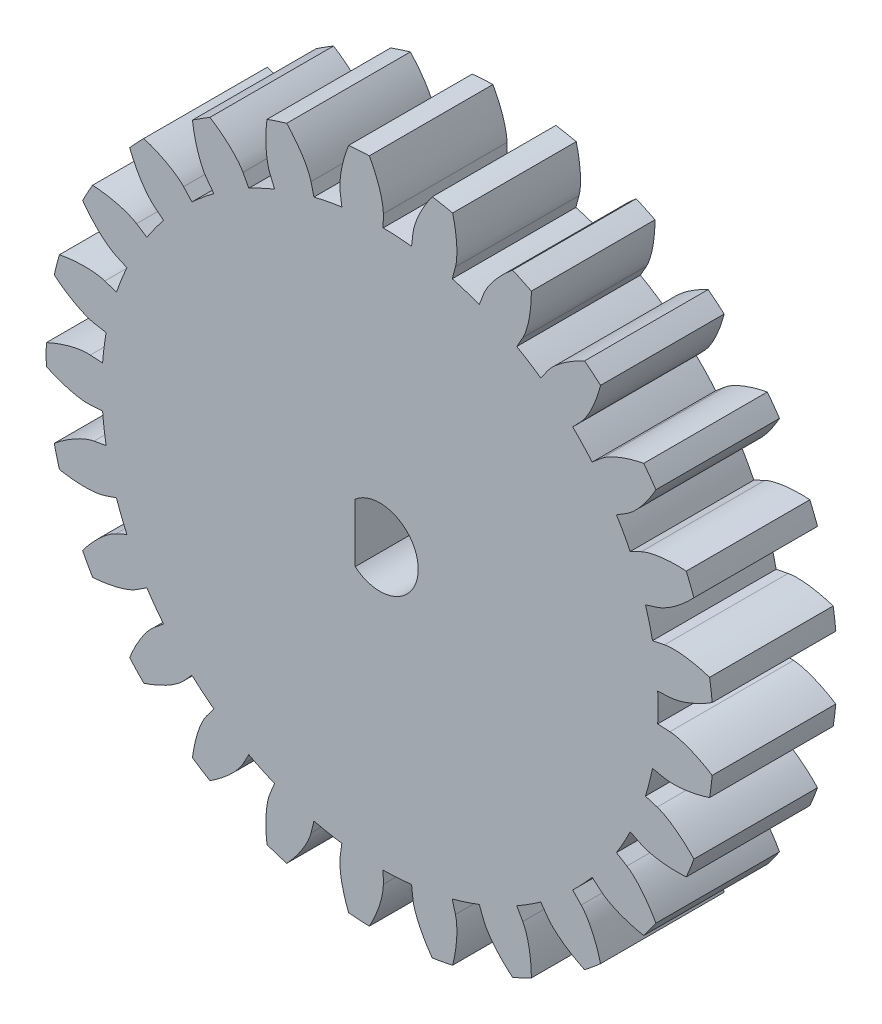
from build123d import *

# Parameters (mm, degrees)
SKETCH_1_R               = 13.5
SKETCH_1_R_2             = 1.5
EXTRUDE_1_DEPTH          = 5
CUT_EXTRUDE_1_DEPTH      = 20.735754356
PATTERN_CIRCULAR_1_DEPTH = 5
SKETCH_2_R               = 1.55
EXTRUDE_2_DEPTH          = 5
CUT_EXTRUDE_2_DEPTH      = 20.731096475


with BuildPart() as part:
    # 草图1 → 凸台-拉伸1 (new body)
    with BuildSketch(Plane.XY):
        Circle(SKETCH_1_R)
        Circle(SKETCH_1_R_2, mode=Mode.SUBTRACT)
    extrude(amount=EXTRUDE_1_DEPTH)

    # 草图1<3> → 切除-拉伸1 (cut, through all)
    with BuildSketch(Plane.XY):
        with BuildLine():
            Line((11.730793662, 0.600584865), (11.235284882, 0.575216158))
            ThreePointArc((11.235284882, 0.575216158), (11.246320619, 0.287702174), (11.25, 0))
            ThreePointArc((11.25, 0), (11.246320619, -0.287702174), (11.235284882, -0.575216158))
            Line((11.235284882, -0.575216158), (11.730793662, -0.600584865))
            add(Edge.make_bspline(
                [(11.730793662, -0.600584865), (11.775456213, -0.602871467), (11.864323988, -0.61161083), (12.031646502, -0.643255468), (12.273517711, -0.709278533), (12.66800179, -0.851104438), (13.004851693, -1.015658352), (13.259698023, -1.161601678), (13.439641435, -1.275161985)],
                knots=[0, 0, 0, 0, 0, 0.002802034, 0.005604068, 0.010661158, 0.015718248, 0.029067116, 0.029067116, 0.029067116, 0.029067116, 0.029067116], degree=4))
            ThreePointArc((13.439641435, -1.275161985), (13.484901916, -0.638294847), (13.5, 0))
            ThreePointArc((13.5, 0), (13.484901916, 0.638294847), (13.439641435, 1.275161985))
            add(Edge.make_bspline(
                [(11.730793662, 0.600584865), (11.775456213, 0.602871467), (11.864323988, 0.61161083), (12.031646502, 0.643255468), (12.273517711, 0.709278533), (12.66800179, 0.851104438), (13.004851693, 1.015658352), (13.259698023, 1.161601678), (13.439641435, 1.275161985)],
                knots=[0, 0, 0, 0, 0, 0.002802034, 0.005604068, 0.010661158, 0.015718248, 0.029067116, 0.029067116, 0.029067116, 0.029067116, 0.029067116], degree=4))
        make_face()
    extrude(amount=CUT_EXTRUDE_1_DEPTH, mode=Mode.SUBTRACT)

    # 阵列(圆周)1: read off the stored shape, not the designer's step
    # 阵列(圆周)1 outline → 阵列(圆周)1 (cut)
    with BuildSketch(Plane.XY):
        with BuildLine():
            Line((11.025358188, 2.236957045), (11.51160859, 2.335613365))
            add(Edge.make_bspline(
                [(11.51160859, 2.335613365), (11.55543664, 2.344505726), (11.643685862, 2.358141443), (11.813621332, 2.369102397), (12.064312981, 2.36530449), (12.481674285, 2.326038509), (12.848864324, 2.250425523), (13.131998817, 2.172444981), (13.334530276, 2.107202485)],
                knots=[0, 0, 0, 0, 0, 0.002802034, 0.005604068, 0.010661158, 0.015718248, 0.029067116, 0.029067116, 0.029067116, 0.029067116, 0.029067116], degree=4))
            ThreePointArc((13.334530276, 2.107202485), (13.075872675, 3.357313477), (12.700290495, 4.577403339))
            add(Edge.make_bspline(
                [(11.212889825, 3.499046139), (11.255580566, 3.512368028), (11.339483005, 3.542933345), (11.493679073, 3.615195225), (11.711532184, 3.739294979), (12.058352152, 3.974769363), (12.343696402, 4.217924677), (12.554241637, 4.42266063), (12.700290495, 4.577403339)],
                knots=[0, 0, 0, 0, 0, 0.002802034, 0.005604068, 0.010661158, 0.015718248, 0.029067116, 0.029067116, 0.029067116, 0.029067116, 0.029067116], degree=4))
            Line((11.212889825, 3.499046139), (10.739257306, 3.351246414))
            ThreePointArc((10.739257306, 3.351246414), (10.896560563, 2.797761231), (11.025358188, 2.236957045))
        make_face()
        with BuildLine():
            add(Edge.make_bspline(
                [(11.212889825, -3.499046139), (11.255580566, -3.512368028), (11.339483005, -3.542933345), (11.493679073, -3.615195225), (11.711532184, -3.739294979), (12.058352152, -3.974769363), (12.343696402, -4.217924677), (12.554241637, -4.42266063), (12.700290496, -4.577403339)],
                knots=[0, 0, 0, 0, 0, 0.002802034, 0.005604068, 0.010661158, 0.015718248, 0.029067116, 0.029067116, 0.029067116, 0.029067116, 0.029067116], degree=4))
            ThreePointArc((12.700290496, -4.577403339), (13.075872675, -3.357313477), (13.334530276, -2.107202485))
            add(Edge.make_bspline(
                [(11.51160859, -2.335613365), (11.55543664, -2.344505726), (11.643685862, -2.358141443), (11.813621332, -2.369102397), (12.064312981, -2.36530449), (12.481674285, -2.326038509), (12.848864324, -2.250425523), (13.131998817, -2.172444981), (13.334530276, -2.107202485)],
                knots=[0, 0, 0, 0, 0, 0.002802034, 0.005604068, 0.010661158, 0.015718248, 0.029067116, 0.029067116, 0.029067116, 0.029067116, 0.029067116], degree=4))
            Line((11.51160859, -2.335613365), (11.025358188, -2.236957045))
            ThreePointArc((11.025358188, -2.236957045), (10.896560563, -2.797761231), (10.739257306, -3.351246414))
            Line((10.739257306, -3.351246414), (11.212889825, -3.499046139))
        make_face()
        with BuildLine():
            add(Edge.make_bspline(
                [(9.990438883, -6.177649476), (10.028475396, -6.201169588), (10.102140601, -6.251640328), (10.233521517, -6.359978971), (10.413668018, -6.534357768), (10.691031901, -6.84868491), (10.906941268, -7.155163283), (11.059956077, -7.40582755), (11.162933596, -7.592029606)],
                knots=[0, 0, 0, 0, 0, 0.002802034, 0.005604068, 0.010661158, 0.015718248, 0.029067116, 0.029067116, 0.029067116, 0.029067116, 0.029067116], degree=4))
            ThreePointArc((11.162933596, -7.592029606), (11.83014018, -6.5036746), (12.391561538, -5.357163674))
            add(Edge.make_bspline(
                [(10.569106814, -5.125056417), (10.609346484, -5.144569001), (10.69143213, -5.179723017), (10.853302886, -5.232600844), (11.097063097, -5.291266734), (11.511077281, -5.357027901), (11.885535554, -5.375106885), (12.179167829, -5.369988931), (12.391561538, -5.357163674)],
                knots=[0, 0, 0, 0, 0, 0.002802034, 0.005604068, 0.010661158, 0.015718248, 0.029067116, 0.029067116, 0.029067116, 0.029067116, 0.029067116], degree=4))
            Line((10.569106814, -5.125056417), (10.122667691, -4.90857401))
            ThreePointArc((10.122667691, -4.90857401), (9.85845015, -5.419728834), (9.568442697, -5.916705533))
            Line((9.568442697, -5.916705533), (9.990438883, -6.177649476))
        make_face()
        with BuildLine():
            add(Edge.make_bspline(
                [(8.140251923, -8.468088376), (8.171244235, -8.500328857), (8.23004355, -8.567533757), (8.330354167, -8.705141848), (8.461474792, -8.918842827), (8.651954797, -9.292272397), (8.784862903, -9.642816664), (8.870732802, -9.923659088), (8.924168523, -10.129620732)],
                knots=[0, 0, 0, 0, 0, 0.002802034, 0.005604068, 0.010661158, 0.015718248, 0.029067116, 0.029067116, 0.029067116, 0.029067116, 0.029067116], degree=4))
            ThreePointArc((8.924168523, -10.129620732), (9.84107647, -9.24138593), (10.669985417, -8.270514567))
            add(Edge.make_bspline(
                [(8.962509186, -7.592473327), (8.996632071, -7.621380086), (9.067396396, -7.675843543), (9.211031505, -7.767315737), (9.432543926, -7.884759229), (9.817196957, -8.051415529), (10.175394874, -8.162050514), (10.461074935, -8.230116727), (10.669985417, -8.270514567)],
                knots=[0, 0, 0, 0, 0, 0.002802034, 0.005604068, 0.010661158, 0.015718248, 0.029067116, 0.029067116, 0.029067116, 0.029067116, 0.029067116], degree=4))
            Line((8.962509186, -7.592473327), (8.583932755, -7.271767217))
            ThreePointArc((8.583932755, -7.271767217), (8.200897058, -7.701154942), (7.796407643, -8.110396283))
            Line((7.796407643, -8.110396283), (8.140251923, -8.468088376))
        make_face()
        with BuildLine():
            add(Edge.make_bspline(
                [(5.778582997, -10.22644614), (5.800583747, -10.265381202), (5.840822594, -10.345097531), (5.903760029, -10.503328647), (5.977615985, -10.74292419), (6.069243553, -11.151992235), (6.110799292, -11.524576411), (6.12412876, -11.817950629), (6.124665122, -12.030730532)],
                knots=[0, 0, 0, 0, 0, 0.002802034, 0.005604068, 0.010661158, 0.015718248, 0.029067116, 0.029067116, 0.029067116, 0.029067116, 0.029067116], degree=4))
            ThreePointArc((6.124665122, -12.030730532), (7.233661732, -11.398426994), (8.27797487, -10.664198613))
            add(Edge.make_bspline(
                [(6.792764144, -9.582827214), (6.818626177, -9.61931183), (6.8736228, -9.68966259), (6.989997138, -9.813981616), (7.175343331, -9.982823304), (7.506466042, -10.239903108), (7.825896711, -10.436142491), (8.085674229, -10.573116021), (8.27797487, -10.664198613)],
                knots=[0, 0, 0, 0, 0, 0.002802034, 0.005604068, 0.010661158, 0.015718248, 0.029067116, 0.029067116, 0.029067116, 0.029067116, 0.029067116], degree=4))
            Line((6.792764144, -9.582827214), (6.505837754, -9.178048546))
            ThreePointArc((6.505837754, -9.178048546), (6.028051444, -9.498689162), (5.534495624, -9.794481007))
            Line((5.534495624, -9.794481007), (5.778582997, -10.22644614))
        make_face()
        with BuildLine():
            add(Edge.make_bspline(
                [(3.053824449, -11.342238683), (3.065451249, -11.385421892), (3.084601274, -11.472640781), (3.106210935, -11.641552679), (3.118161582, -11.891988117), (3.105179416, -12.310991386), (3.052771688, -12.682204637), (2.992723185, -12.969676868), (2.940326486, -13.175905288)],
                knots=[0, 0, 0, 0, 0, 0.002802034, 0.005604068, 0.010661158, 0.015718248, 0.029067116, 0.029067116, 0.029067116, 0.029067116, 0.029067116], degree=4))
            ThreePointArc((2.940326486, -13.175905288), (4.171729424, -12.83926297), (5.365828717, -12.387811839))
            add(Edge.make_bspline(
                [(4.196204749, -10.971056824), (4.212180923, -11.012826835), (4.247954204, -11.0946445), (4.329755544, -11.243998936), (4.467289524, -11.453629876), (4.72407626, -11.784979915), (4.984668677, -12.054493254), (5.202220874, -12.25176755), (5.365828717, -12.387811839)],
                knots=[0, 0, 0, 0, 0, 0.002802034, 0.005604068, 0.010661158, 0.015718248, 0.029067116, 0.029067116, 0.029067116, 0.029067116, 0.029067116], degree=4))
            Line((4.196204749, -10.971056824), (4.01895704, -10.507639331))
            ThreePointArc((4.01895704, -10.507639331), (3.476441187, -10.699385808), (2.92483089, -10.863142467))
            Line((2.92483089, -10.863142467), (3.053824449, -11.342238683))
        make_face()
        with BuildLine():
            add(Edge.make_bspline(
                [(0.13718288, -11.745356656), (0.137705176, -11.790074653), (0.134563112, -11.879315817), (0.113487185, -12.048295141), (0.062781619, -12.293834695), (-0.053994564, -12.696445672), (-0.197072788, -13.042963304), (-0.326726194, -13.306470611), (-0.428763677, -13.493189457)],
                knots=[0, 0, 0, 0, 0, 0.002802034, 0.005604068, 0.010661158, 0.015718248, 0.029067116, 0.029067116, 0.029067116, 0.029067116, 0.029067116], degree=4))
            ThreePointArc((-0.428763677, -13.493189457), (0.847672014, -13.473360834), (2.116527813, -13.333053289))
            add(Edge.make_bspline(
                [(1.335982377, -11.669934585), (1.341068851, -11.714365427), (1.355371022, -11.802509093), (1.397459485, -11.967514451), (1.478539488, -12.204762759), (1.644855392, -12.589563092), (1.830235577, -12.915415873), (1.99189285, -13.160595466), (2.116527813, -13.333053289)],
                knots=[0, 0, 0, 0, 0, 0.002802034, 0.005604068, 0.010661158, 0.015718248, 0.029067116, 0.029067116, 0.029067116, 0.029067116, 0.029067116], degree=4))
            Line((1.335982377, -11.669934585), (1.279550475, -11.176996492))
            ThreePointArc((1.279550475, -11.176996492), (0.706393345, -11.227800695), (0.131388275, -11.249232735))
            Line((0.131388275, -11.249232735), (0.13718288, -11.745356656))
        make_face()
        with BuildLine():
            add(Edge.make_bspline(
                [(-2.788078394, -11.410470673), (-2.798693421, -11.453913662), (-2.823930146, -11.539569751), (-2.886367383, -11.697998909), (-2.996543144, -11.923214425), (-3.209775867, -12.284135582), (-3.434534457, -12.584184618), (-3.625646165, -12.807169868), (-3.770913041, -12.962646907)],
                knots=[0, 0, 0, 0, 0, 0.002802034, 0.005604068, 0.010661158, 0.015718248, 0.029067116, 0.029067116, 0.029067116, 0.029067116, 0.029067116], degree=4))
            ThreePointArc((-3.770913041, -12.962646907), (-2.529647747, -13.260877885), (-1.265762319, -13.440529965))
            add(Edge.make_bspline(
                [(-1.608184681, -11.635547437), (-1.614307509, -11.679847358), (-1.622375105, -11.768778634), (-1.622644093, -11.939067019), (-1.603112623, -12.189025513), (-1.53771779, -12.603097719), (-1.439197956, -12.964815413), (-1.343593128, -13.242494766), (-1.265762319, -13.440529965)],
                knots=[0, 0, 0, 0, 0, 0.002802034, 0.005604068, 0.010661158, 0.015718248, 0.029067116, 0.029067116, 0.029067116, 0.029067116, 0.029067116], degree=4))
            Line((-1.608184681, -11.635547437), (-1.540254953, -11.144061857))
            ThreePointArc((-1.540254953, -11.144061857), (-2.108039789, -11.050731571), (-2.670309949, -10.928492338))
            Line((-2.670309949, -10.928492338), (-2.788078394, -11.410470673))
        make_face()
        with BuildLine():
            add(Edge.make_bspline(
                [(-5.538154448, -10.358622854), (-5.559239817, -10.398061151), (-5.604985487, -10.474750078), (-5.704860873, -10.612674383), (-5.867584081, -10.803414742), (-6.163875148, -11.099968075), (-6.456191694, -11.334695331), (-6.696753453, -11.50314754), (-6.87612207, -11.617613579)],
                knots=[0, 0, 0, 0, 0, 0.002802034, 0.005604068, 0.010661158, 0.015718248, 0.029067116, 0.029067116, 0.029067116, 0.029067116, 0.029067116], degree=4))
            ThreePointArc((-6.87612207, -11.617613579), (-5.748020436, -12.215165208), (-4.568519948, -12.703488713))
            add(Edge.make_bspline(
                [(-4.451303582, -10.870056051), (-4.468250992, -10.911441523), (-4.498181439, -10.99557253), (-4.540790975, -11.160444098), (-4.584035271, -11.407406965), (-4.623670507, -11.824733365), (-4.618201387, -12.199587919), (-4.594656209, -12.492319419), (-4.568519948, -12.703488713)],
                knots=[0, 0, 0, 0, 0, 0.002802034, 0.005604068, 0.010661158, 0.015718248, 0.029067116, 0.029067116, 0.029067116, 0.029067116, 0.029067116], degree=4))
            Line((-4.451303582, -10.870056051), (-4.263280497, -10.410904831))
            ThreePointArc((-4.263280497, -10.410904831), (-4.79001703, -10.17930434), (-5.304222778, -9.921074575))
            Line((-5.304222778, -9.921074575), (-5.538154448, -10.358622854))
        make_face()
        with BuildLine():
            add(Edge.make_bspline(
                [(-7.940247891, -8.655904664), (-7.970478729, -8.688860216), (-8.033858976, -8.751763335), (-8.164896973, -8.860516495), (-8.36994313, -9.004796779), (-8.730675483, -9.218348752), (-9.072182663, -9.37300545), (-9.347079092, -9.476340147), (-9.549279061, -9.542602864)],
                knots=[0, 0, 0, 0, 0, 0.002802034, 0.005604068, 0.010661158, 0.015718248, 0.029067116, 0.029067116, 0.029067116, 0.029067116, 0.029067116], degree=4))
            ThreePointArc((-9.549279061, -9.542602864), (-8.605223862, -10.401928777), (-7.584220668, -11.168240544))
            add(Edge.make_bspline(
                [(-7.014730707, -9.421559066), (-7.041437832, -9.457429688), (-7.091350489, -9.531474165), (-7.17362326, -9.680569429), (-7.276926124, -9.909019084), (-7.419101002, -10.303377525), (-7.507026242, -10.667815449), (-7.557020142, -10.957205698), (-7.584220668, -11.168240544)],
                knots=[0, 0, 0, 0, 0, 0.002802034, 0.005604068, 0.010661158, 0.015718248, 0.029067116, 0.029067116, 0.029067116, 0.029067116, 0.029067116], degree=4))
            Line((-7.014730707, -9.421559066), (-6.718428448, -9.023592366))
            ThreePointArc((-6.718428448, -9.023592366), (-7.171019884, -8.668273982), (-7.604851782, -8.29027921))
            Line((-7.604851782, -8.29027921), (-7.940247891, -8.655904664))
        make_face()
        with BuildLine():
            add(Edge.make_bspline(
                [(-9.843426357, -6.40930415), (-9.88090315, -6.433706239), (-9.957935559, -6.478871114), (-10.111902568, -6.551619769), (-10.34638787, -6.640374317), (-10.748895369, -6.757506673), (-11.11813503, -6.822375166), (-11.410093376, -6.85409945), (-11.622419729, -6.867995315)],
                knots=[0, 0, 0, 0, 0, 0.002802034, 0.005604068, 0.010661158, 0.015718248, 0.029067116, 0.029067116, 0.029067116, 0.029067116, 0.029067116], degree=4))
            ThreePointArc((-11.622419729, -6.867995315), (-10.921729424, -7.935100906), (-10.12337691, -8.931250749))
            add(Edge.make_bspline(
                [(-9.137396503, -7.381070875), (-9.172185236, -7.409172763), (-9.238943908, -7.468478224), (-9.355710413, -7.59242898), (-9.512580947, -7.788011091), (-9.748362096, -8.134622582), (-9.924157028, -8.465744901), (-10.044548706, -8.733610446), (-10.12337691, -8.931250749)],
                knots=[0, 0, 0, 0, 0, 0.002802034, 0.005604068, 0.010661158, 0.015718248, 0.029067116, 0.029067116, 0.029067116, 0.029067116, 0.029067116], degree=4))
            Line((-9.137396503, -7.381070875), (-8.751432832, -7.069294406))
            ThreePointArc((-8.751432832, -7.069294406), (-9.101441187, -6.612584088), (-9.42763998, -6.138575112))
            Line((-9.42763998, -6.138575112), (-9.843426357, -6.40930415))
        make_face()
        with BuildLine():
            add(Edge.make_bspline(
                [(-11.128106143, -3.759983484), (-11.170474087, -3.774298837), (-11.256318428, -3.798887593), (-11.423540135, -3.831060678), (-11.672731009, -3.858712715), (-12.091722628, -3.872065599), (-12.465494083, -3.843069959), (-12.75616953, -3.801190478), (-12.965281021, -3.761846362)],
                knots=[0, 0, 0, 0, 0, 0.002802034, 0.005604068, 0.010661158, 0.015718248, 0.029067116, 0.029067116, 0.029067116, 0.029067116, 0.029067116], degree=4))
            ThreePointArc((-12.965281021, -3.761846362), (-12.551982559, -4.969681461), (-12.02644415, -6.133077621))
            add(Edge.make_bspline(
                [(-10.685926073, -4.876802855), (-10.726610508, -4.895370265), (-10.806020502, -4.936210329), (-10.949943873, -5.027228295), (-11.150525324, -5.177653719), (-11.465097747, -5.454739386), (-11.71771653, -5.731740466), (-11.900941334, -5.961250329), (-12.02644415, -6.133077621)],
                knots=[0, 0, 0, 0, 0, 0.002802034, 0.005604068, 0.010661158, 0.015718248, 0.029067116, 0.029067116, 0.029067116, 0.029067116, 0.029067116], degree=4))
            Line((-10.685926073, -4.876802855), (-10.234552504, -4.670806679))
            ThreePointArc((-10.234552504, -4.670806679), (-10.459985466, -4.141401218), (-10.658054886, -3.601161764))
            Line((-10.658054886, -3.601161764), (-11.128106143, -3.759983484))
        make_face()
        with BuildLine():
            add(Edge.make_bspline(
                [(-11.713566093, -0.874409228), (-11.758163054, -0.877738359), (-11.847425413, -0.880205994), (-12.017394663, -0.869781955), (-12.26563353, -0.834594001), (-12.674782483, -0.743328402), (-13.029600298, -0.622290532), (-13.300728638, -0.509438728), (-13.493486023, -0.419326767)],
                knots=[0, 0, 0, 0, 0, 0.002802034, 0.005604068, 0.010661158, 0.015718248, 0.029067116, 0.029067116, 0.029067116, 0.029067116, 0.029067116], degree=4))
            ThreePointArc((-13.493486023, -0.419326767), (-13.393548468, -1.691998653), (-13.173845673, -2.949540671))
            add(Edge.make_bspline(
                [(-11.563019607, -2.066107376), (-11.607043393, -2.073973649), (-11.694115087, -2.093782185), (-11.856152088, -2.146148367), (-12.087841185, -2.241965322), (-12.46143914, -2.432114853), (-12.775008807, -2.637589697), (-13.00955405, -2.814322931), (-13.173845673, -2.949540671)],
                knots=[0, 0, 0, 0, 0, 0.002802034, 0.005604068, 0.010661158, 0.015718248, 0.029067116, 0.029067116, 0.029067116, 0.029067116, 0.029067116], degree=4))
            Line((-11.563019607, -2.066107376), (-11.074597604, -1.978834991))
            ThreePointArc((-11.074597604, -1.978834991), (-11.16129039, -1.409998878), (-11.218785006, -0.837474178))
            Line((-11.218785006, -0.837474178), (-11.713566093, -0.874409228))
        make_face()
        with BuildLine():
            add(Edge.make_bspline(
                [(-11.563019607, 2.066107376), (-11.607043393, 2.073973649), (-11.694115087, 2.093782185), (-11.856152088, 2.146148367), (-12.087841185, 2.241965322), (-12.46143914, 2.432114853), (-12.775008807, 2.637589697), (-13.00955405, 2.814322931), (-13.173845673, 2.949540671)],
                knots=[0, 0, 0, 0, 0, 0.002802034, 0.005604068, 0.010661158, 0.015718248, 0.029067116, 0.029067116, 0.029067116, 0.029067116, 0.029067116], degree=4))
            ThreePointArc((-13.173845673, 2.949540671), (-13.393548468, 1.691998653), (-13.493486023, 0.419326767))
            add(Edge.make_bspline(
                [(-11.713566093, 0.874409228), (-11.758163054, 0.877738359), (-11.847425413, 0.880205994), (-12.017394663, 0.869781955), (-12.26563353, 0.834594001), (-12.674782483, 0.743328402), (-13.029600298, 0.622290532), (-13.300728638, 0.509438728), (-13.493486023, 0.419326767)],
                knots=[0, 0, 0, 0, 0, 0.002802034, 0.005604068, 0.010661158, 0.015718248, 0.029067116, 0.029067116, 0.029067116, 0.029067116, 0.029067116], degree=4))
            Line((-11.713566093, 0.874409228), (-11.218785006, 0.837474178))
            ThreePointArc((-11.218785006, 0.837474178), (-11.16129039, 1.409998878), (-11.074597604, 1.978834991))
            Line((-11.074597604, 1.978834991), (-11.563019607, 2.066107376))
        make_face()
        with BuildLine():
            add(Edge.make_bspline(
                [(-10.685926073, 4.876802855), (-10.726610508, 4.895370265), (-10.806020502, 4.936210329), (-10.949943873, 5.027228295), (-11.150525324, 5.177653719), (-11.465097747, 5.454739386), (-11.71771653, 5.731740466), (-11.900941334, 5.961250329), (-12.02644415, 6.133077621)],
                knots=[0, 0, 0, 0, 0, 0.002802034, 0.005604068, 0.010661158, 0.015718248, 0.029067116, 0.029067116, 0.029067116, 0.029067116, 0.029067116], degree=4))
            ThreePointArc((-12.02644415, 6.133077621), (-12.551982559, 4.969681461), (-12.965281021, 3.761846362))
            add(Edge.make_bspline(
                [(-11.128106143, 3.759983484), (-11.170474087, 3.774298837), (-11.256318428, 3.798887593), (-11.423540135, 3.831060678), (-11.672731009, 3.858712715), (-12.091722628, 3.872065599), (-12.465494083, 3.843069959), (-12.75616953, 3.801190478), (-12.965281021, 3.761846362)],
                knots=[0, 0, 0, 0, 0, 0.002802034, 0.005604068, 0.010661158, 0.015718248, 0.029067116, 0.029067116, 0.029067116, 0.029067116, 0.029067116], degree=4))
            Line((-11.128106143, 3.759983484), (-10.658054886, 3.601161764))
            ThreePointArc((-10.658054886, 3.601161764), (-10.459985466, 4.141401218), (-10.234552504, 4.670806679))
            Line((-10.234552504, 4.670806679), (-10.685926073, 4.876802855))
        make_face()
        with BuildLine():
            add(Edge.make_bspline(
                [(-9.137396503, 7.381070875), (-9.172185236, 7.409172763), (-9.238943908, 7.468478224), (-9.355710413, 7.59242898), (-9.512580947, 7.788011091), (-9.748362096, 8.134622582), (-9.924157028, 8.465744901), (-10.044548706, 8.733610446), (-10.12337691, 8.931250749)],
                knots=[0, 0, 0, 0, 0, 0.002802034, 0.005604068, 0.010661158, 0.015718248, 0.029067116, 0.029067116, 0.029067116, 0.029067116, 0.029067116], degree=4))
            ThreePointArc((-10.12337691, 8.931250749), (-10.921729424, 7.935100906), (-11.622419729, 6.867995315))
            add(Edge.make_bspline(
                [(-9.843426357, 6.40930415), (-9.88090315, 6.433706239), (-9.957935559, 6.478871114), (-10.111902568, 6.551619769), (-10.34638787, 6.640374317), (-10.748895369, 6.757506673), (-11.11813503, 6.822375166), (-11.410093376, 6.85409945), (-11.622419729, 6.867995315)],
                knots=[0, 0, 0, 0, 0, 0.002802034, 0.005604068, 0.010661158, 0.015718248, 0.029067116, 0.029067116, 0.029067116, 0.029067116, 0.029067116], degree=4))
            Line((-9.843426357, 6.40930415), (-9.42763998, 6.138575112))
            ThreePointArc((-9.42763998, 6.138575112), (-9.101441187, 6.612584088), (-8.751432832, 7.069294406))
            Line((-8.751432832, 7.069294406), (-9.137396503, 7.381070875))
        make_face()
        with BuildLine():
            add(Edge.make_bspline(
                [(-7.014730707, 9.421559066), (-7.041437832, 9.457429688), (-7.091350489, 9.531474165), (-7.17362326, 9.680569429), (-7.276926124, 9.909019084), (-7.419101002, 10.303377525), (-7.507026242, 10.667815449), (-7.557020142, 10.957205698), (-7.584220668, 11.168240544)],
                knots=[0, 0, 0, 0, 0, 0.002802034, 0.005604068, 0.010661158, 0.015718248, 0.029067116, 0.029067116, 0.029067116, 0.029067116, 0.029067116], degree=4))
            ThreePointArc((-7.584220668, 11.168240544), (-8.605223862, 10.401928777), (-9.549279061, 9.542602864))
            add(Edge.make_bspline(
                [(-7.940247891, 8.655904664), (-7.970478729, 8.688860216), (-8.033858976, 8.751763335), (-8.164896973, 8.860516495), (-8.36994313, 9.004796779), (-8.730675483, 9.218348752), (-9.072182663, 9.37300545), (-9.347079092, 9.476340147), (-9.549279061, 9.542602864)],
                knots=[0, 0, 0, 0, 0, 0.002802034, 0.005604068, 0.010661158, 0.015718248, 0.029067116, 0.029067116, 0.029067116, 0.029067116, 0.029067116], degree=4))
            Line((-7.940247891, 8.655904664), (-7.604851782, 8.29027921))
            ThreePointArc((-7.604851782, 8.29027921), (-7.171019884, 8.668273982), (-6.718428448, 9.023592366))
            Line((-6.718428448, 9.023592366), (-7.014730707, 9.421559066))
        make_face()
        with BuildLine():
            add(Edge.make_bspline(
                [(-4.451303582, 10.870056051), (-4.468250992, 10.911441523), (-4.498181439, 10.99557253), (-4.540790975, 11.160444098), (-4.584035271, 11.407406965), (-4.623670507, 11.824733365), (-4.618201387, 12.199587919), (-4.594656209, 12.492319419), (-4.568519949, 12.703488713)],
                knots=[0, 0, 0, 0, 0, 0.002802034, 0.005604068, 0.010661158, 0.015718248, 0.029067116, 0.029067116, 0.029067116, 0.029067116, 0.029067116], degree=4))
            ThreePointArc((-4.568519949, 12.703488713), (-5.748020436, 12.215165208), (-6.87612207, 11.617613579))
            add(Edge.make_bspline(
                [(-5.538154448, 10.358622854), (-5.559239817, 10.398061151), (-5.604985487, 10.474750078), (-5.704860873, 10.612674383), (-5.867584081, 10.803414742), (-6.163875148, 11.099968075), (-6.456191694, 11.334695331), (-6.696753453, 11.50314754), (-6.87612207, 11.617613579)],
                knots=[0, 0, 0, 0, 0, 0.002802034, 0.005604068, 0.010661158, 0.015718248, 0.029067116, 0.029067116, 0.029067116, 0.029067116, 0.029067116], degree=4))
            Line((-5.538154448, 10.358622854), (-5.304222778, 9.921074575))
            ThreePointArc((-5.304222778, 9.921074575), (-4.79001703, 10.17930434), (-4.263280497, 10.410904831))
            Line((-4.263280497, 10.410904831), (-4.451303582, 10.870056051))
        make_face()
        with BuildLine():
            add(Edge.make_bspline(
                [(-1.608184681, 11.635547437), (-1.614307509, 11.679847358), (-1.622375105, 11.768778634), (-1.622644093, 11.939067019), (-1.603112623, 12.189025513), (-1.53771779, 12.603097719), (-1.439197956, 12.964815413), (-1.343593128, 13.242494766), (-1.265762319, 13.440529965)],
                knots=[0, 0, 0, 0, 0, 0.002802034, 0.005604068, 0.010661158, 0.015718248, 0.029067116, 0.029067116, 0.029067116, 0.029067116, 0.029067116], degree=4))
            ThreePointArc((-1.265762319, 13.440529965), (-2.529647747, 13.260877885), (-3.770913041, 12.962646907))
            add(Edge.make_bspline(
                [(-2.788078394, 11.410470673), (-2.798693421, 11.453913662), (-2.823930146, 11.539569751), (-2.886367383, 11.697998909), (-2.996543144, 11.923214425), (-3.209775867, 12.284135582), (-3.434534457, 12.584184618), (-3.625646165, 12.807169868), (-3.770913041, 12.962646907)],
                knots=[0, 0, 0, 0, 0, 0.002802034, 0.005604068, 0.010661158, 0.015718248, 0.029067116, 0.029067116, 0.029067116, 0.029067116, 0.029067116], degree=4))
            Line((-2.788078394, 11.410470673), (-2.670309949, 10.928492338))
            ThreePointArc((-2.670309949, 10.928492338), (-2.108039789, 11.050731571), (-1.540254953, 11.144061857))
            Line((-1.540254953, 11.144061857), (-1.608184681, 11.635547437))
        make_face()
        with BuildLine():
            add(Edge.make_bspline(
                [(1.335982377, 11.669934585), (1.341068851, 11.714365427), (1.355371022, 11.802509093), (1.397459485, 11.967514451), (1.478539488, 12.204762759), (1.644855392, 12.589563092), (1.830235577, 12.915415873), (1.99189285, 13.160595466), (2.116527813, 13.333053289)],
                knots=[0, 0, 0, 0, 0, 0.002802034, 0.005604068, 0.010661158, 0.015718248, 0.029067116, 0.029067116, 0.029067116, 0.029067116, 0.029067116], degree=4))
            ThreePointArc((2.116527813, 13.333053289), (0.847672014, 13.473360834), (-0.428763677, 13.493189456))
            add(Edge.make_bspline(
                [(0.13718288, 11.745356656), (0.137705176, 11.790074653), (0.134563112, 11.879315817), (0.113487185, 12.048295141), (0.062781619, 12.293834695), (-0.053994564, 12.696445672), (-0.197072788, 13.042963304), (-0.326726194, 13.306470611), (-0.428763677, 13.493189456)],
                knots=[0, 0, 0, 0, 0, 0.002802034, 0.005604068, 0.010661158, 0.015718248, 0.029067116, 0.029067116, 0.029067116, 0.029067116, 0.029067116], degree=4))
            Line((0.13718288, 11.745356656), (0.131388275, 11.249232735))
            ThreePointArc((0.131388275, 11.249232735), (0.706393345, 11.227800695), (1.279550475, 11.176996492))
            Line((1.279550475, 11.176996492), (1.335982377, 11.669934585))
        make_face()
        with BuildLine():
            add(Edge.make_bspline(
                [(4.196204749, 10.971056824), (4.212180923, 11.012826835), (4.247954204, 11.0946445), (4.329755544, 11.243998936), (4.467289524, 11.453629876), (4.72407626, 11.784979915), (4.984668677, 12.054493254), (5.202220874, 12.25176755), (5.365828717, 12.38781184)],
                knots=[0, 0, 0, 0, 0, 0.002802034, 0.005604068, 0.010661158, 0.015718248, 0.029067116, 0.029067116, 0.029067116, 0.029067116, 0.029067116], degree=4))
            ThreePointArc((5.365828717, 12.38781184), (4.171729424, 12.83926297), (2.940326486, 13.175905288))
            add(Edge.make_bspline(
                [(3.053824449, 11.342238683), (3.065451249, 11.385421892), (3.084601274, 11.472640781), (3.106210935, 11.641552679), (3.118161582, 11.891988117), (3.105179416, 12.310991386), (3.052771688, 12.682204637), (2.992723185, 12.969676868), (2.940326486, 13.175905288)],
                knots=[0, 0, 0, 0, 0, 0.002802034, 0.005604068, 0.010661158, 0.015718248, 0.029067116, 0.029067116, 0.029067116, 0.029067116, 0.029067116], degree=4))
            Line((3.053824449, 11.342238683), (2.92483089, 10.863142467))
            ThreePointArc((2.92483089, 10.863142467), (3.476441187, 10.699385808), (4.01895704, 10.507639331))
            Line((4.01895704, 10.507639331), (4.196204749, 10.971056824))
        make_face()
        with BuildLine():
            add(Edge.make_bspline(
                [(6.792764144, 9.582827214), (6.818626177, 9.61931183), (6.8736228, 9.68966259), (6.989997138, 9.813981616), (7.175343331, 9.982823304), (7.506466042, 10.239903108), (7.825896711, 10.436142491), (8.085674229, 10.573116021), (8.27797487, 10.664198613)],
                knots=[0, 0, 0, 0, 0, 0.002802034, 0.005604068, 0.010661158, 0.015718248, 0.029067116, 0.029067116, 0.029067116, 0.029067116, 0.029067116], degree=4))
            ThreePointArc((8.27797487, 10.664198613), (7.233661732, 11.398426994), (6.124665122, 12.030730532))
            add(Edge.make_bspline(
                [(5.778582997, 10.22644614), (5.800583747, 10.265381202), (5.840822594, 10.345097531), (5.903760029, 10.503328647), (5.977615985, 10.74292419), (6.069243553, 11.151992235), (6.110799292, 11.524576411), (6.12412876, 11.817950629), (6.124665122, 12.030730532)],
                knots=[0, 0, 0, 0, 0, 0.002802034, 0.005604068, 0.010661158, 0.015718248, 0.029067116, 0.029067116, 0.029067116, 0.029067116, 0.029067116], degree=4))
            Line((5.778582997, 10.22644614), (5.534495624, 9.794481007))
            ThreePointArc((5.534495624, 9.794481007), (6.028051444, 9.498689162), (6.505837754, 9.178048546))
            Line((6.505837754, 9.178048546), (6.792764144, 9.582827214))
        make_face()
        with BuildLine():
            add(Edge.make_bspline(
                [(8.962509186, 7.592473327), (8.996632071, 7.621380086), (9.067396396, 7.675843543), (9.211031505, 7.767315737), (9.432543926, 7.884759229), (9.817196957, 8.051415529), (10.175394874, 8.162050514), (10.461074935, 8.230116727), (10.669985417, 8.270514567)],
                knots=[0, 0, 0, 0, 0, 0.002802034, 0.005604068, 0.010661158, 0.015718248, 0.029067116, 0.029067116, 0.029067116, 0.029067116, 0.029067116], degree=4))
            ThreePointArc((10.669985417, 8.270514567), (9.84107647, 9.24138593), (8.924168523, 10.129620731))
            add(Edge.make_bspline(
                [(8.140251923, 8.468088376), (8.171244235, 8.500328857), (8.23004355, 8.567533757), (8.330354167, 8.705141848), (8.461474792, 8.918842827), (8.651954797, 9.292272397), (8.784862903, 9.642816664), (8.870732802, 9.923659088), (8.924168523, 10.129620731)],
                knots=[0, 0, 0, 0, 0, 0.002802034, 0.005604068, 0.010661158, 0.015718248, 0.029067116, 0.029067116, 0.029067116, 0.029067116, 0.029067116], degree=4))
            Line((8.140251923, 8.468088376), (7.796407643, 8.110396283))
            ThreePointArc((7.796407643, 8.110396283), (8.200897058, 7.701154942), (8.583932755, 7.271767217))
            Line((8.583932755, 7.271767217), (8.962509186, 7.592473327))
        make_face()
        with BuildLine():
            add(Edge.make_bspline(
                [(10.569106814, 5.125056417), (10.609346484, 5.144569001), (10.69143213, 5.179723017), (10.853302886, 5.232600844), (11.097063097, 5.291266734), (11.511077281, 5.357027901), (11.885535554, 5.375106885), (12.179167829, 5.369988931), (12.391561539, 5.357163674)],
                knots=[0, 0, 0, 0, 0, 0.002802034, 0.005604068, 0.010661158, 0.015718248, 0.029067116, 0.029067116, 0.029067116, 0.029067116, 0.029067116], degree=4))
            ThreePointArc((12.391561539, 5.357163674), (11.83014018, 6.5036746), (11.162933595, 7.592029606))
            add(Edge.make_bspline(
                [(9.990438883, 6.177649476), (10.028475396, 6.201169588), (10.102140601, 6.251640328), (10.233521517, 6.359978971), (10.413668018, 6.534357768), (10.691031901, 6.84868491), (10.906941268, 7.155163283), (11.059956077, 7.40582755), (11.162933595, 7.592029606)],
                knots=[0, 0, 0, 0, 0, 0.002802034, 0.005604068, 0.010661158, 0.015718248, 0.029067116, 0.029067116, 0.029067116, 0.029067116, 0.029067116], degree=4))
            Line((9.990438883, 6.177649476), (9.568442697, 5.916705533))
            ThreePointArc((9.568442697, 5.916705533), (9.85845015, 5.419728834), (10.122667691, 4.90857401))
            Line((10.122667691, 4.90857401), (10.569106814, 5.125056417))
        make_face()
    extrude(amount=PATTERN_CIRCULAR_1_DEPTH, mode=Mode.SUBTRACT)

    # 草图2 → 凸台-拉伸2 (add, through all)
    with BuildSketch(Plane(origin=(0, 0, 0), x_dir=(-1, 0, 0), z_dir=(0, 0, -1))):
        Circle(SKETCH_2_R)
    extrude(amount=-EXTRUDE_2_DEPTH)

    # 草图2<3> → 切除-拉伸2 (cut, through all)
    with BuildSketch(Plane(origin=(0, 0, 0), x_dir=(-1, 0, 0), z_dir=(0, 0, -1))):
        with BuildLine():
            Line((1, -1.184271928), (1, 1.184271928))
            ThreePointArc((1, 1.184271928), (-1.55, 0), (1, -1.184271928))
        make_face()
    extrude(amount=-CUT_EXTRUDE_2_DEPTH, mode=Mode.SUBTRACT)


solid = part.part
